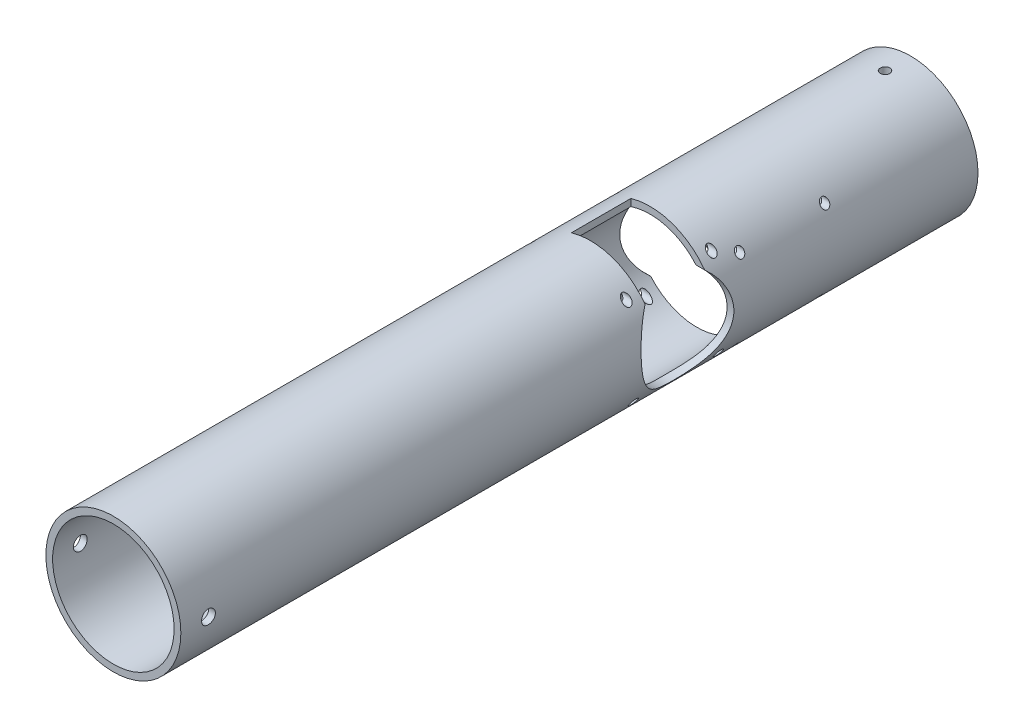
from build123d import *

# Parameters (mm, degrees)
BOSS_EXTRUDE1_DEPTH      = 125
BOSS_EXTRUDE1_DEPTH_BACK = 250
SKETCH1_R                = 31.75
SKETCH1_R_2              = 28.575
SKETCH2_R                = 21.75
CUT_EXTRUDE1_DEPTH       = 255.000246063
SKETCH3_R                = 21.75
CUT_EXTRUDE2_DEPTH       = 255.000246186
CUT_EXTRUDE4_START       = 9
SKETCH5_W                = 28
SKETCH5_H                = 22
CUT_EXTRUDE4_DEPTH       = 264.000246186
CUT_EXTRUDE5_START       = -9
SKETCH6_W                = 28
SKETCH6_H                = 22
CUT_EXTRUDE5_DEPTH       = 264.000246186
CUT_EXTRUDE8_DEPTH       = 255.000246186
CUT_EXTRUDE8_DEPTH_BACK  = 255.000246186
SKETCH11_R               = 2
CUT_EXTRUDE10_DEPTH      = 255.000246186
CUT_EXTRUDE10_DEPTH_BACK = 255.000246186
SKETCH12_R               = 3.25
CUT_EXTRUDE11_DEPTH      = 255.000246186
CUT_EXTRUDE11_DEPTH_BACK = 255.000246186
SKETCH13_R               = 2.25
CUT_EXTRUDE12_DEPTH      = 255.000246189
CUT_EXTRUDE12_DEPTH_BACK = 255.000246189
SKETCH15_R               = 2


with BuildPart() as part:
    # Sketch1 → Boss-Extrude1 (new, two sides: drawn at the far end of the back side and taken through both)
    with BuildSketch(Plane.XY.offset(-BOSS_EXTRUDE1_DEPTH_BACK)):
        Circle(SKETCH1_R)
        Circle(SKETCH1_R_2, mode=Mode.SUBTRACT)
    extrude(amount=BOSS_EXTRUDE1_DEPTH + BOSS_EXTRUDE1_DEPTH_BACK)

    # Sketch2 → Cut-Extrude1 (cut, through all)
    with BuildSketch(Plane(origin=(0, 0, 0), x_dir=(0, 0, -1), z_dir=(1, 0, 0))):
        with Locations((163.488, -2)):
            Circle(SKETCH2_R)
    extrude(amount=-CUT_EXTRUDE1_DEPTH, mode=Mode.SUBTRACT)

    # Sketch3 → Cut-Extrude2 (cut, through all)
    with BuildSketch(Plane(origin=(0, 0, 0), x_dir=(0, 0, -1), z_dir=(1, 0, 0))):
        with Locations((113.45, 2)):
            Circle(SKETCH3_R)
    extrude(amount=CUT_EXTRUDE2_DEPTH, mode=Mode.SUBTRACT)

    # Sketch5 → Cut-Extrude4 (cut, through all)
    with BuildSketch(Plane(origin=(0, 0, 0), x_dir=(0, 0, -1), z_dir=(1, 0, 0)).offset(CUT_EXTRUDE4_START)):
        with Locations((163.488, -23.75)):
            Rectangle(SKETCH5_W, SKETCH5_H)
    extrude(amount=-CUT_EXTRUDE4_DEPTH, mode=Mode.SUBTRACT)

    # Sketch6 → Cut-Extrude5 (cut, through all)
    with BuildSketch(Plane(origin=(0, 0, 0), x_dir=(0, 0, -1), z_dir=(1, 0, 0)).offset(CUT_EXTRUDE5_START)):
        with Locations((113.45, 23.75)):
            Rectangle(SKETCH6_W, SKETCH6_H)
    extrude(amount=CUT_EXTRUDE5_DEPTH, mode=Mode.SUBTRACT)

    # Sketch11 → Cut-Extrude8 (cut, two sides: drawn at the far end of the back side and taken through both)
    with BuildSketch(Plane(origin=(0, 0, 0), x_dir=(0, 0, -1), z_dir=(1, 0, 0)).offset(-CUT_EXTRUDE8_DEPTH_BACK)):
        with Locations((183.488, 18)):
            Circle(SKETCH11_R)
        with Locations((143.488, 18)):
            Circle(SKETCH11_R)
        with Locations((143.488, -22)):
            Circle(SKETCH11_R)
        with Locations((183.488, -22)):
            Circle(SKETCH11_R)
    extrude(amount=CUT_EXTRUDE8_DEPTH + CUT_EXTRUDE8_DEPTH_BACK, mode=Mode.SUBTRACT)

    # Sketch12 → Cut-Extrude10 (cut, two sides: drawn at the far end of the back side and taken through both)
    with BuildSketch(Plane(origin=(0, 0, 0), x_dir=(0, 0, -1), z_dir=(1, 0, 0)).offset(-CUT_EXTRUDE10_DEPTH_BACK)):
        with Locations((-136, 0)):
            Circle(SKETCH12_R)
        with Locations((-112, 0)):
            Circle(SKETCH12_R)
    extrude(amount=CUT_EXTRUDE10_DEPTH + CUT_EXTRUDE10_DEPTH_BACK, mode=Mode.SUBTRACT)

    # Sketch13 → Cut-Extrude11 (cut, two sides: drawn at the far end of the back side and taken through both)
    with BuildSketch(Plane(origin=(0, 0, 0), x_dir=(1, 0, 0), z_dir=(0, 1, 0)).offset(-CUT_EXTRUDE11_DEPTH_BACK)):
        with Locations((0, 238)):
            Circle(SKETCH13_R)
    extrude(amount=CUT_EXTRUDE11_DEPTH + CUT_EXTRUDE11_DEPTH_BACK, mode=Mode.SUBTRACT)

    # Sketch15 → Cut-Extrude12 (cut, two sides: drawn at the far end of the back side and taken through both)
    with BuildSketch(Plane(origin=(0, 0, 0), x_dir=(0, 0, -1), z_dir=(1, 0, 0)).offset(-CUT_EXTRUDE12_DEPTH_BACK)):
        with Locations((93.45, 22)):
            Circle(SKETCH15_R)
        with Locations((133.45, 22)):
            Circle(SKETCH15_R)
        with Locations((133.45, -18)):
            Circle(SKETCH15_R)
        with Locations((93.45, -18)):
            Circle(SKETCH15_R)
    extrude(amount=CUT_EXTRUDE12_DEPTH + CUT_EXTRUDE12_DEPTH_BACK, mode=Mode.SUBTRACT)


solid = part.part
